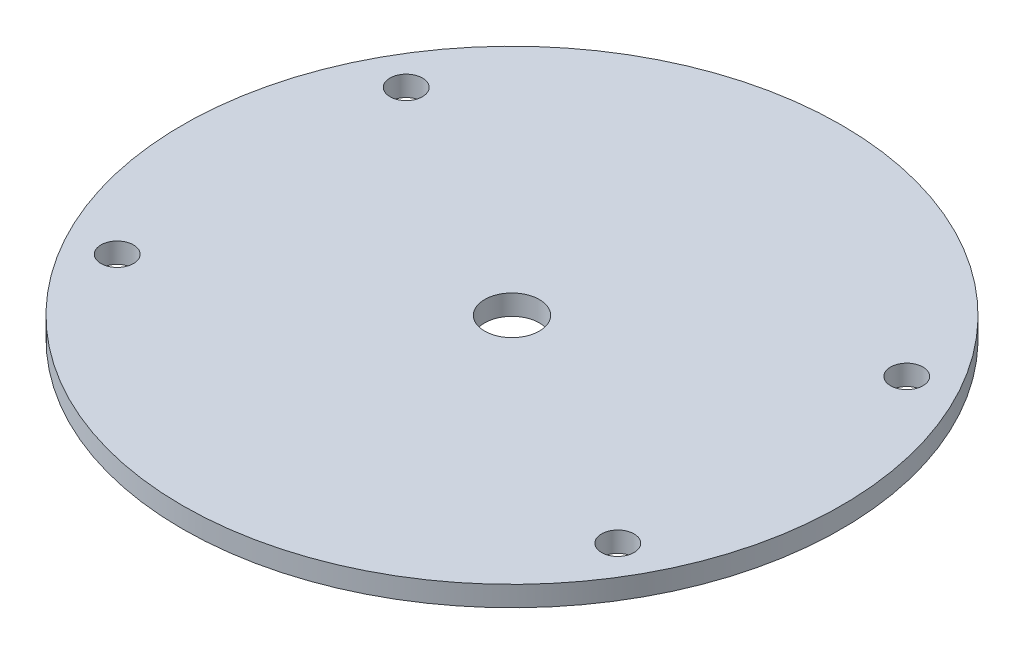
from build123d import *

# Parameters (mm, degrees)
SKETCH_1_R      = 32.5
SKETCH_1_R_2    = 1.6
SKETCH_1_R_3    = 2.7
EXTRUDE_1_DEPTH = 2


with BuildPart() as part:
    # 草图1 → 凸台-拉伸1 (new body)
    with BuildSketch(Plane(origin=(0, 0, 0), x_dir=(1, 0, 0), z_dir=(0, 1, 0))):
        Circle(SKETCH_1_R)
        with Locations((24.681724008, -14.25)):
            Circle(SKETCH_1_R_2, mode=Mode.SUBTRACT)
        with Locations((-24.681724008, -14.25)):
            Circle(SKETCH_1_R_2, mode=Mode.SUBTRACT)
        with Locations((24.681724008, 14.25)):
            Circle(SKETCH_1_R_2, mode=Mode.SUBTRACT)
        with Locations((-24.681724008, 14.25)):
            Circle(SKETCH_1_R_2, mode=Mode.SUBTRACT)
        Circle(SKETCH_1_R_3, mode=Mode.SUBTRACT)
    extrude(amount=EXTRUDE_1_DEPTH)


solid = part.part
